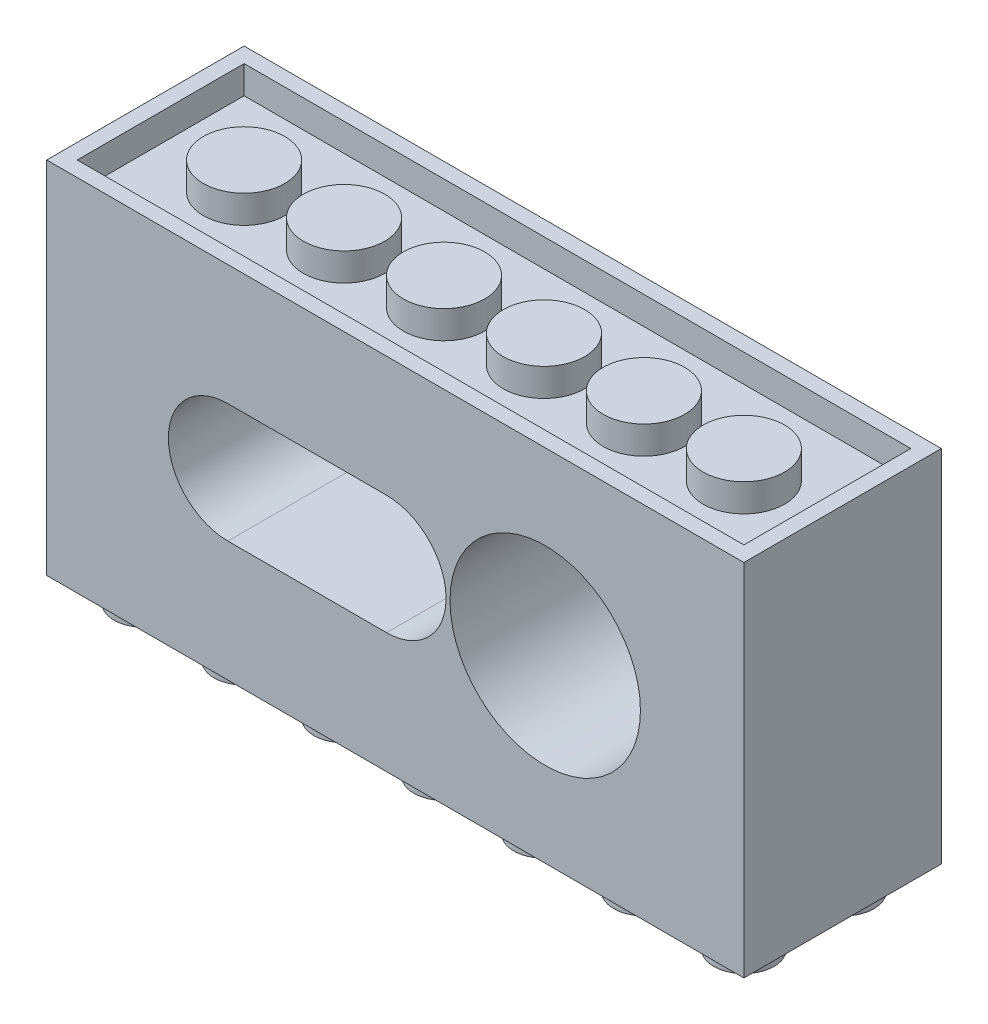
from build123d import *

# Parameters (mm, degrees)
SKETCH1_W           = 55.8
SKETCH1_H           = 15.8
BOSS_EXTRUDE1_DEPTH = 28.8
SKETCH2_R           = 7.62
CUT_EXTRUDE1_DEPTH  = 12.7
SKETCH4_R           = 2.778125
SKETCH4_R_2         = 1.8415
CUT_EXTRUDE2_DEPTH  = 12.7
CUT_EXTRUDE6_START  = -1.905
CUT_EXTRUDE6_DEPTH  = 1.905
SKETCH8_W           = 53.36
SKETCH8_H           = 13.36
SKETCH8_R           = 3.26
CUT_EXTRUDE8_DEPTH  = 2.23
SKETCH11_R          = 2.405
BOSS_EXTRUDE3_DEPTH = 1.9


with BuildPart() as part:
    # Sketch1 → Boss-Extrude1 (new body)
    with BuildSketch(Plane(origin=(0, 0, 0), x_dir=(1, 0, 0), z_dir=(0, 1, 0))):
        with Locations((-11.199948696, 8.193463303)):
            Rectangle(SKETCH1_W, SKETCH1_H)
    extrude(amount=BOSS_EXTRUDE1_DEPTH)

    # Sketch2 → Cut-Extrude1 (cut)
    with BuildSketch(Plane.XY.offset(-0.293463303)):
        with Locations((0.800051304, 14.4)):
            Circle(SKETCH2_R)
        with BuildLine():
            Line((-11.899948696, 9.6375), (-24.599948696, 9.6375))
            ThreePointArc((-24.599948696, 9.6375), (-29.362448696, 14.4), (-24.599948696, 19.1625))
            Line((-24.599948696, 19.1625), (-11.899948696, 19.1625))
            ThreePointArc((-11.899948696, 19.1625), (-7.137448696, 14.4), (-11.899948696, 9.6375))
        make_face()
    extrude(amount=-CUT_EXTRUDE1_DEPTH, mode=Mode.SUBTRACT)

    # Sketch4 → Cut-Extrude2 (cut)
    with BuildSketch(Plane(origin=(0, 0, -16.093463303), x_dir=(-1, 0, 0), z_dir=(0, 0, -1))):
        with Locations((-0.800051304, 14.4)):
            Circle(SKETCH4_R)
        with Locations((11.899948696, 14.4)):
            Circle(SKETCH4_R_2)
        with Locations((24.599948696, 14.4)):
            Circle(SKETCH4_R_2)
    extrude(amount=-CUT_EXTRUDE2_DEPTH, mode=Mode.SUBTRACT)

    # Sketch5 → Cut-Extrude6 (cut)
    with BuildSketch(Plane(origin=(0, 0, -16.093463303), x_dir=(-1, 0, 0), z_dir=(0, 0, -1)).offset(CUT_EXTRUDE6_START)):
        with BuildLine():
            Line((24.599948696, 19.1625), (11.899948696, 19.1625))
            ThreePointArc((11.899948696, 19.1625), (7.137448696, 14.4), (11.899948696, 9.6375))
            Line((11.899948696, 9.6375), (24.599948696, 9.6375))
            ThreePointArc((24.599948696, 9.6375), (29.362448696, 14.4), (24.599948696, 19.1625))
        make_face()
    extrude(amount=CUT_EXTRUDE6_DEPTH, mode=Mode.SUBTRACT)

    # Sketch8 → Cut-Extrude8 (cut)
    with BuildSketch(Plane(origin=(0, 28.8, 0), x_dir=(1, 0, 0), z_dir=(0, 1, 0))):
        with Locations((-11.199948696, 8.193463303)):
            Rectangle(SKETCH8_W, SKETCH8_H)
        with Locations((-31.199948696, 8.193463303)):
            Circle(SKETCH8_R, mode=Mode.SUBTRACT)
        with Locations((-23.199948696, 8.193463303)):
            Circle(SKETCH8_R, mode=Mode.SUBTRACT)
        with Locations((-15.199948696, 8.193463303)):
            Circle(SKETCH8_R, mode=Mode.SUBTRACT)
        with Locations((-7.199948696, 8.193463303)):
            Circle(SKETCH8_R, mode=Mode.SUBTRACT)
        with Locations((0.800051304, 8.193463303)):
            Circle(SKETCH8_R, mode=Mode.SUBTRACT)
        with Locations((8.800051304, 8.193463303)):
            Circle(SKETCH8_R, mode=Mode.SUBTRACT)
    extrude(amount=-CUT_EXTRUDE8_DEPTH, mode=Mode.SUBTRACT)

    # Sketch11 → Boss-Extrude3 (add)
    with BuildSketch(Plane.XZ):
        with Locations((-35.199948696, -4.193463303)):
            Circle(SKETCH11_R)
        with Locations((-35.199948696, -12.193463303)):
            Circle(SKETCH11_R)
        with Locations((-27.199948696, -4.193463303)):
            Circle(SKETCH11_R)
        with Locations((-27.199948696, -12.193463303)):
            Circle(SKETCH11_R)
        with Locations((-19.199948696, -4.193463303)):
            Circle(SKETCH11_R)
        with Locations((-19.199948696, -12.193463303)):
            Circle(SKETCH11_R)
        with Locations((-11.199948696, -4.193463303)):
            Circle(SKETCH11_R)
        with Locations((-11.199948696, -12.193463303)):
            Circle(SKETCH11_R)
        with Locations((-3.199948696, -4.193463303)):
            Circle(SKETCH11_R)
        with Locations((-3.199948696, -12.193463303)):
            Circle(SKETCH11_R)
        with Locations((4.800051304, -4.193463303)):
            Circle(SKETCH11_R)
        with Locations((4.800051304, -12.193463303)):
            Circle(SKETCH11_R)
        with Locations((12.800051304, -4.193463303)):
            Circle(SKETCH11_R)
        with Locations((12.800051304, -12.193463303)):
            Circle(SKETCH11_R)
    extrude(amount=BOSS_EXTRUDE3_DEPTH)


solid = part.part
